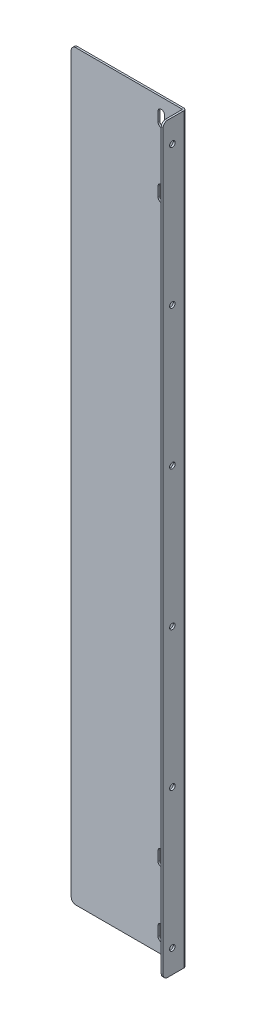
from build123d import *

# Parameters (mm, degrees)
SKETCH_1_W                       = 245
SKETCH_1_H                       = 800
SM_BASE_FLANGE_1_DEPTH           = 2
FILLET_1_R                       = 5
SKETCH_2_W                       = 1
SKETCH_2_H                       = 854.013811654
CUT_EXTRUDE_1_DEPTH              = 10
SKETCH_3_W                       = 130
SKETCH_3_H                       = 800.320249097
CUT_EXTRUDE_2_DEPTH              = 10
SM_EDGE_FLANGE_1_STRIP_W         = 9.4732
SM_EDGE_FLANGE_1_STRIP_H         = 2
SM_EDGE_FLANGE_1_STRIP_CUT_DEPTH = 800
SM_EDGE_FLANGE_1_DEPTH           = 800
FILLET_2_R                       = 5
CUT_EXTRUDE_3_DEPTH              = 10
HOLE_WIZARD_6_0_6_1_D            = 6
PATTERN_LINEAR_1_COUNT           = 6
PATTERN_LINEAR_1_PITCH           = 150


# Sheet-metal steps are written as plain solids
with BuildPart() as part:
    # Sketch 1 → 基体-法兰1 (new body)
    with BuildSketch(Plane.XY):
        Rectangle(SKETCH_1_W, SKETCH_1_H)
    extrude(amount=-SM_BASE_FLANGE_1_DEPTH)

    # 圆角1
    fillet_1_edges = [part.edges().sort_by_distance(p)[0] for p in [
        (-122.5, 400, -1),
        (122.5, 400, -1),
        (122.5, -400, -1),
        (-122.5, -400, -1),
    ]]
    fillet(fillet_1_edges, radius=FILLET_1_R)

    # Sketch 2 → 切除-拉伸1 (cut)
    with BuildSketch(Plane.XY):
        Rectangle(SKETCH_2_W, SKETCH_2_H)
    extrude(amount=-CUT_EXTRUDE_1_DEPTH, mode=Mode.SUBTRACT)


with BuildPart() as cut_extrude_1_piece_1:
    # of the separate pieces the step leaves, piece 1, a body of its own (cut_extrude_1_pieces)
    add(part.part.solids().sort_by_distance((-0.5, -400, 0))[0])

    # 边线-法兰1 strip (across the edge) → 边线-法兰1 strip cut (cut)
    with BuildSketch(Plane(origin=(-0.5, -400, 0), x_dir=(-1, 0, 0), z_dir=(0, 1, 0))):
        with Locations((-2, -1)):
            Rectangle(SM_EDGE_FLANGE_1_STRIP_W, SM_EDGE_FLANGE_1_STRIP_H)
    extrude(amount=SM_EDGE_FLANGE_1_STRIP_CUT_DEPTH, mode=Mode.SUBTRACT)

    # 边线-法兰1 section (across the edge) → 边线-法兰1 (add)
    with BuildSketch(Plane(origin=(-0.5, -400, 0), x_dir=(-1, 0, 0), z_dir=(0, 1, 0))):
        with BuildLine():
            Line((0, 0.7366), (0, 23))
            Line((0, 23), (2, 23))
            Line((2, 23), (2, 0.7366))
            ThreePointArc((2, 0.7366), (2.215745145, 0.215745145), (2.7366, 0))
            Line((2.7366, 0), (2.7366, -2))
            ThreePointArc((2.7366, -2), (0.801531583, -1.198468417), (0, 0.7366))
        make_face()
    extrude(amount=SM_EDGE_FLANGE_1_DEPTH)

    # 圆角2
    fillet_2_edges = [cut_extrude_1_piece_1.edges().sort_by_distance(p)[0] for p in [
        (-1.5, -400, 23),
        (-1.5, 400, 23),
    ]]
    fillet(fillet_2_edges, radius=FILLET_2_R)

    # 草图9 → 切除-拉伸3 (cut)
    with BuildSketch(Plane.XY):
        with BuildLine():
            Line((-22, 385), (-22, 375))
            ThreePointArc((-22, 375), (-25.5, 371.5), (-29, 375))
            Line((-29, 375), (-29, 385))
            ThreePointArc((-29, 385), (-25.5, 388.5), (-22, 385))
        make_face()
        with BuildLine():
            Line((-22, 315), (-22, 305))
            ThreePointArc((-22, 305), (-25.5, 301.5), (-29, 305))
            Line((-29, 305), (-29, 315))
            ThreePointArc((-29, 315), (-25.5, 318.5), (-22, 315))
        make_face()
        with BuildLine():
            Line((-29, -385), (-29, -375))
            ThreePointArc((-29, -375), (-25.5, -371.5), (-22, -375))
            Line((-22, -375), (-22, -385))
            ThreePointArc((-22, -385), (-25.5, -388.5), (-29, -385))
        make_face()
        with BuildLine():
            Line((-22, -305), (-22, -315))
            ThreePointArc((-22, -315), (-25.5, -318.5), (-29, -315))
            Line((-29, -315), (-29, -305))
            ThreePointArc((-29, -305), (-25.5, -301.5), (-22, -305))
        make_face()
    extrude(amount=-CUT_EXTRUDE_3_DEPTH, mode=Mode.SUBTRACT)

    # Ø6.0 (6) 直径孔1 (through all)
    with Locations(Plane.ZY.offset(2.5)):
        with Locations((13, 375)):
            hole_wizard_6_0_6_1 = Hole(HOLE_WIZARD_6_0_6_1_D / 2)

    # 阵列(线性)1: Ø6.0 (6) 直径孔1 ×6
    with Locations(*[(0, -i * PATTERN_LINEAR_1_PITCH, 0) for i in range(1, PATTERN_LINEAR_1_COUNT)]):
        add(hole_wizard_6_0_6_1, mode=Mode.SUBTRACT)


with BuildPart() as cut_extrude_1_piece_2:
    # of the separate pieces the step leaves, piece 2, a body of its own (cut_extrude_1_pieces)
    add(part.part.solids().sort_by_distance((117.5, -400, 0))[0])

    # Sketch 3 → 切除-拉伸2 (cut)
    with BuildSketch(Plane.XY):
        with Locations((65.5, -0.160124549)):
            Rectangle(SKETCH_3_W, SKETCH_3_H)
    extrude(amount=-CUT_EXTRUDE_2_DEPTH, mode=Mode.SUBTRACT)


solid = cut_extrude_1_piece_1.part
